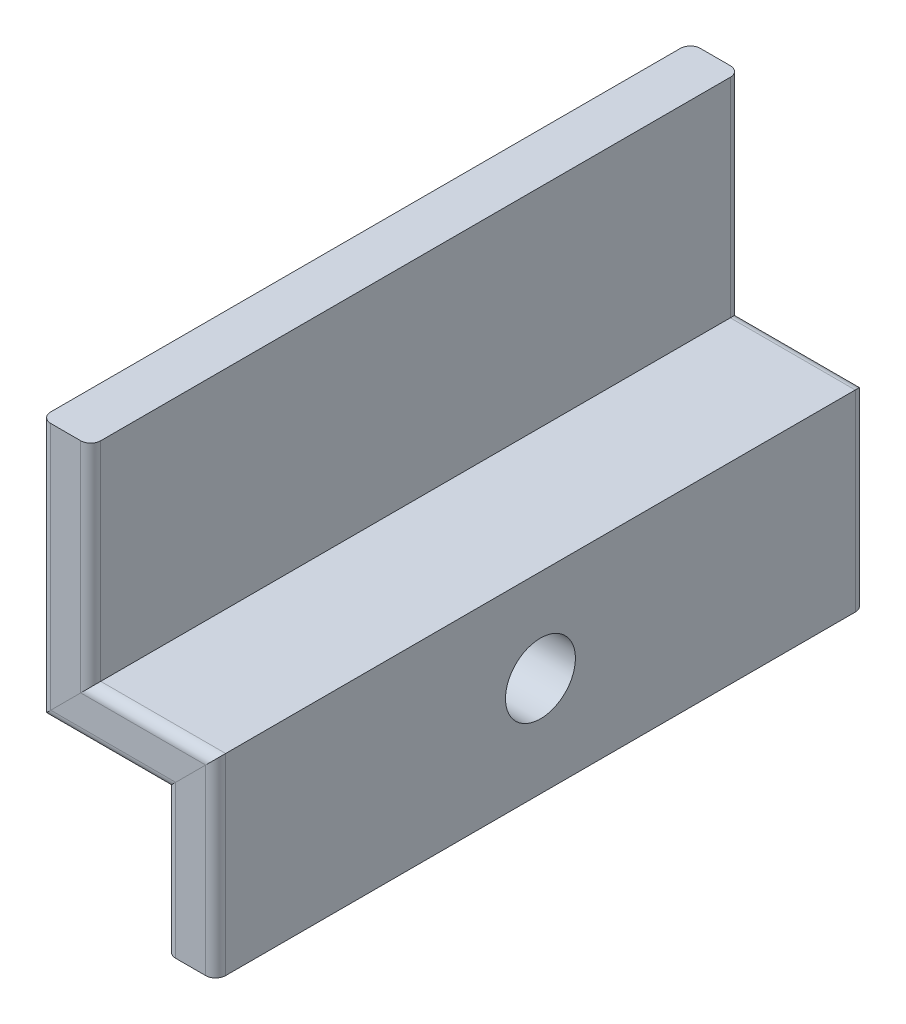
from build123d import *

# Parameters (mm, degrees)
CUT_EXTRUDE1_DEPTH      = 108.503674356
CUT_EXTRUDE1_DEPTH_BACK = 108.503674356
SKETCH3_R               = 7


with BuildPart() as part:
    # Sweep1: sweep along a curve in space
    with BuildLine() as sweep1_path:
        Line((0, 0, 0), (0, 33.5, 0))
        Line((0, 33.5, 0), (-25, 33.5, 0))
        Line((-25, 33.5, 0), (-25, 80.2, 0))
    # Sketch2 → Sweep1 (sweep)
    with BuildSketch(Plane(origin=(0, 0, 0), x_dir=(1, 0, 0), z_dir=(0, 1, 0))):
        with BuildLine():
            Line((-3, 65), (3, 65))
            ThreePointArc((3, 65), (4.414213562, 64.414213562), (5, 63))
            Line((5, 63), (5, -63))
            ThreePointArc((5, -63), (4.414213562, -64.414213562), (3, -65))
            Line((3, -65), (-3, -65))
            ThreePointArc((-3, -65), (-4.414213562, -64.414213562), (-5, -63))
            Line((-5, -63), (-5, 63))
            ThreePointArc((-5, 63), (-4.414213562, 64.414213562), (-3, 65))
        make_face()
    sweep(path=sweep1_path.line, transition=Transition.RIGHT)

    # Sketch3 → Cut-Extrude1 (cut, two sides: drawn at the far end of the back side and taken through both)
    with BuildSketch(Plane(origin=(0, 0, 0), x_dir=(0, 0, -1), z_dir=(1, 0, 0)).offset(-CUT_EXTRUDE1_DEPTH_BACK)):
        with Locations((0, 20)):
            Circle(SKETCH3_R)
    extrude(amount=CUT_EXTRUDE1_DEPTH + CUT_EXTRUDE1_DEPTH_BACK, mode=Mode.SUBTRACT)


solid = part.part
